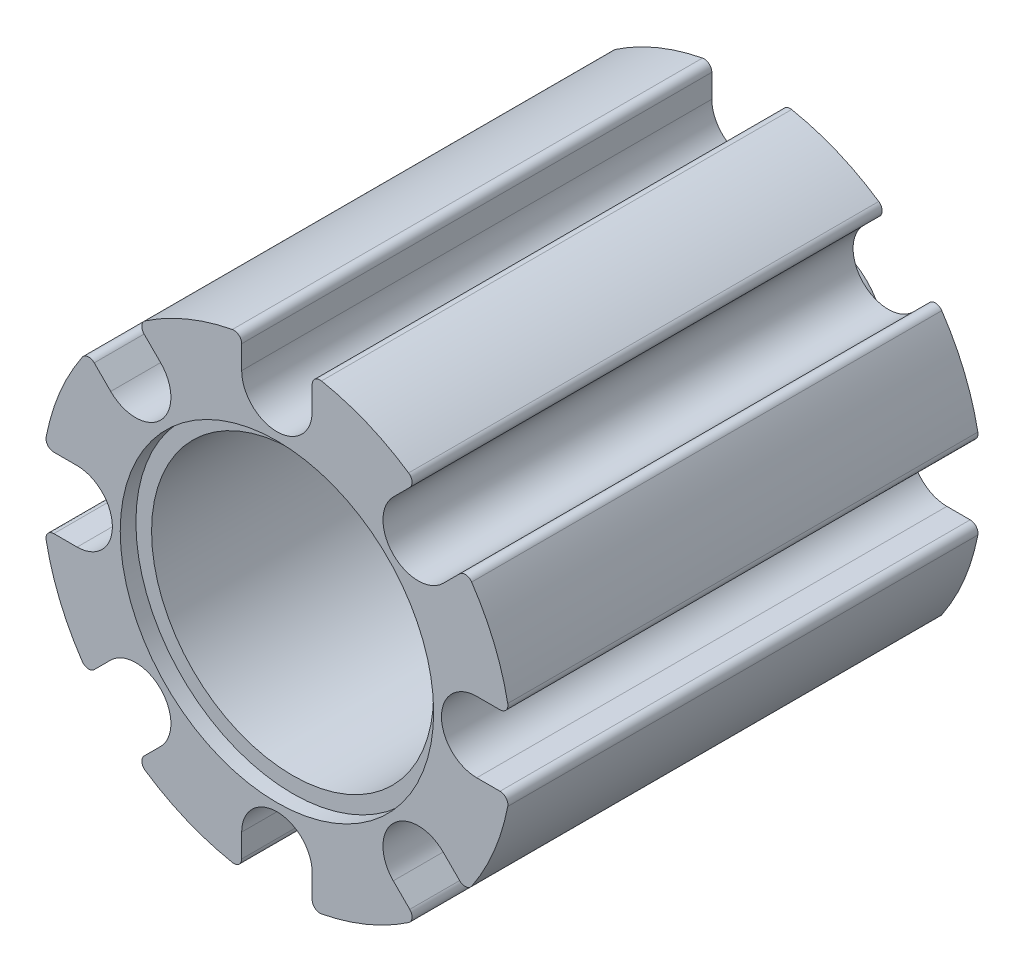
from build123d import *

# Parameters (mm, degrees)
SKETCH_1_R               = 2.5
EXTRUDE_1_DEPTH          = 30
FILLET_1_R               = 0.5
SKETCH_3_R               = 10
CUT_EXTRUDE_1_DEPTH      = 1
SKETCH_4_R               = 9
CUT_EXTRUDE_2_DEPTH      = 20
CHAMFER_1_SIZE           = 0.5
PATTERN_CIRCULAR_3_DEPTH = 30
SKETCH_9_R               = 6
SKETCH_9_R_2             = 2.5
EXTRUDE_3_DEPTH          = 1.5
EXTRUDE_START            = 3.5
SKETCH_10_R              = 3.75
SKETCH_10_R_2            = 2.5
EXTRUDE_4_DEPTH          = 3.5


# Read off the part's stored shape, not the designer's step: 阵列(圆周)3
with BuildPart() as part:
    # 草图1 → 凸台-拉伸1 (new body)
    with BuildSketch(Plane.XY):
        with BuildLine():
            Line((-12.75, 2.25), (-14.83028995, 2.25))
            ThreePointArc((-14.83028995, 2.25), (15, 0), (-14.83028995, -2.25))
            Line((-14.83028995, -2.25), (-12.75, -2.25))
            ThreePointArc((-12.75, -2.25), (-10.5, 0), (-12.75, 2.25))
        make_face()
        Circle(SKETCH_1_R, mode=Mode.SUBTRACT)
    extrude(amount=EXTRUDE_1_DEPTH)

    # 圆角1
    fillet_1_edges = [part.edges().sort_by_distance(p)[0] for p in [
        (-14.83028995, 2.25, 15),
        (-14.83028995, -2.25, 15),
    ]]
    fillet(fillet_1_edges, radius=FILLET_1_R)

    # 草图3 → 切除-拉伸1 (cut)
    with BuildSketch(Plane.XY.offset(30)):
        Circle(SKETCH_3_R)
    extrude(amount=-CUT_EXTRUDE_1_DEPTH, mode=Mode.SUBTRACT)

    # 草图4 → 切除-拉伸2 (cut)
    with BuildSketch(Plane.XY.offset(29)):
        Circle(SKETCH_4_R)
    extrude(amount=-CUT_EXTRUDE_2_DEPTH, mode=Mode.SUBTRACT)

    # 倒角1
    chamfer_1_edges = [part.edges().sort_by_distance(p)[0] for p in [
        (-2.5, 0, 9),
    ]]
    chamfer(chamfer_1_edges, length=CHAMFER_1_SIZE)

    # 阵列(圆周)3 outline → 阵列(圆周)3 (cut)
    with BuildSketch(Plane.XY):
        with BuildLine():
            ThreePointArc((-12.425696839, -8.402503084), (-10.606601718, -10.606601718), (-8.402503084, -12.425696839))
            ThreePointArc((-8.402503084, -12.425696839), (-8.620145822, -12.059137344), (-8.475973038, -11.657953554))
            Line((-8.475973038, -11.657953554), (-7.424621202, -10.606601718))
            ThreePointArc((-7.424621202, -10.606601718), (-7.424621202, -7.424621202), (-10.606601718, -7.424621202))
            Line((-10.606601718, -7.424621202), (-11.657953554, -8.475973038))
            ThreePointArc((-11.657953554, -8.475973038), (-12.059137344, -8.620145822), (-12.425696839, -8.402503084))
        make_face()
        with BuildLine():
            ThreePointArc((-8.475973038, 11.657953554), (-8.620145822, 12.059137344), (-8.402503084, 12.425696839))
            ThreePointArc((-8.402503084, 12.425696839), (-10.606601718, 10.606601718), (-12.425696839, 8.402503084))
            ThreePointArc((-12.425696839, 8.402503084), (-12.059137344, 8.620145822), (-11.657953554, 8.475973038))
            Line((-11.657953554, 8.475973038), (-10.606601718, 7.424621202))
            ThreePointArc((-10.606601718, 7.424621202), (-7.424621202, 7.424621202), (-7.424621202, 10.606601718))
            Line((-7.424621202, 10.606601718), (-8.475973038, 11.657953554))
        make_face()
        with BuildLine():
            ThreePointArc((2.25, 14.236836025), (2.431734225, 14.622461357), (2.844827586, 14.727761405))
            ThreePointArc((2.844827586, 14.727761405), (0, 15), (-2.844827586, 14.727761405))
            ThreePointArc((-2.844827586, 14.727761405), (-2.431734225, 14.622461357), (-2.25, 14.236836025))
            Line((-2.25, 14.236836025), (-2.25, 12.75))
            ThreePointArc((-2.25, 12.75), (0, 10.5), (2.25, 12.75))
            Line((2.25, 12.75), (2.25, 14.236836025))
        make_face()
        with BuildLine():
            ThreePointArc((11.657953554, 8.475973038), (12.059137344, 8.620145822), (12.425696839, 8.402503084))
            ThreePointArc((12.425696839, 8.402503084), (10.606601718, 10.606601718), (8.402503084, 12.425696839))
            ThreePointArc((8.402503084, 12.425696839), (8.620145822, 12.059137344), (8.475973038, 11.657953554))
            Line((8.475973038, 11.657953554), (7.424621202, 10.606601718))
            ThreePointArc((7.424621202, 10.606601718), (7.424621202, 7.424621202), (10.606601718, 7.424621202))
            Line((10.606601718, 7.424621202), (11.657953554, 8.475973038))
        make_face()
        with BuildLine():
            ThreePointArc((14.236836025, -2.25), (14.622461357, -2.431734225), (14.727761405, -2.844827586))
            ThreePointArc((14.727761405, -2.844827586), (15, 0), (14.727761405, 2.844827586))
            ThreePointArc((14.727761405, 2.844827586), (14.622461357, 2.431734225), (14.236836025, 2.25))
            Line((14.236836025, 2.25), (12.75, 2.25))
            ThreePointArc((12.75, 2.25), (10.5, 0), (12.75, -2.25))
            Line((12.75, -2.25), (14.236836025, -2.25))
        make_face()
        with BuildLine():
            ThreePointArc((8.475973038, -11.657953554), (8.620145822, -12.059137344), (8.402503084, -12.425696839))
            ThreePointArc((8.402503084, -12.425696839), (10.606601718, -10.606601718), (12.425696839, -8.402503084))
            ThreePointArc((12.425696839, -8.402503084), (12.059137344, -8.620145822), (11.657953554, -8.475973038))
            Line((11.657953554, -8.475973038), (10.606601718, -7.424621202))
            ThreePointArc((10.606601718, -7.424621202), (7.424621202, -7.424621202), (7.424621202, -10.606601718))
            Line((7.424621202, -10.606601718), (8.475973038, -11.657953554))
        make_face()
        with BuildLine():
            ThreePointArc((-2.25, -14.236836025), (-2.431734225, -14.622461357), (-2.844827586, -14.727761405))
            ThreePointArc((-2.844827586, -14.727761405), (0, -15), (2.844827586, -14.727761405))
            ThreePointArc((2.844827586, -14.727761405), (2.431734225, -14.622461357), (2.25, -14.236836025))
            Line((2.25, -14.236836025), (2.25, -12.75))
            ThreePointArc((2.25, -12.75), (0, -10.5), (-2.25, -12.75))
            Line((-2.25, -12.75), (-2.25, -14.236836025))
        make_face()
    extrude(amount=PATTERN_CIRCULAR_3_DEPTH, mode=Mode.SUBTRACT)


with BuildPart() as body_2:
    # 草图9 → 凸台-拉伸3 (new body)
    with BuildSketch(Plane(origin=(0, 0, 0), x_dir=(-1, 0, 0), z_dir=(0, 0, -1))):
        Circle(SKETCH_9_R)
        Circle(SKETCH_9_R_2, mode=Mode.SUBTRACT)
    extrude(amount=EXTRUDE_3_DEPTH)

    # 草图10 → 凸台-拉伸4 (add)
    with BuildSketch(Plane(origin=(0, 0, -1.5), x_dir=(-1, 0, 0), z_dir=(0, 0, -1)).offset(EXTRUDE_START)):
        Circle(SKETCH_10_R)
        Circle(SKETCH_10_R_2, mode=Mode.SUBTRACT)
    extrude(amount=-EXTRUDE_4_DEPTH)


solid = Compound([part.part, body_2.part])
